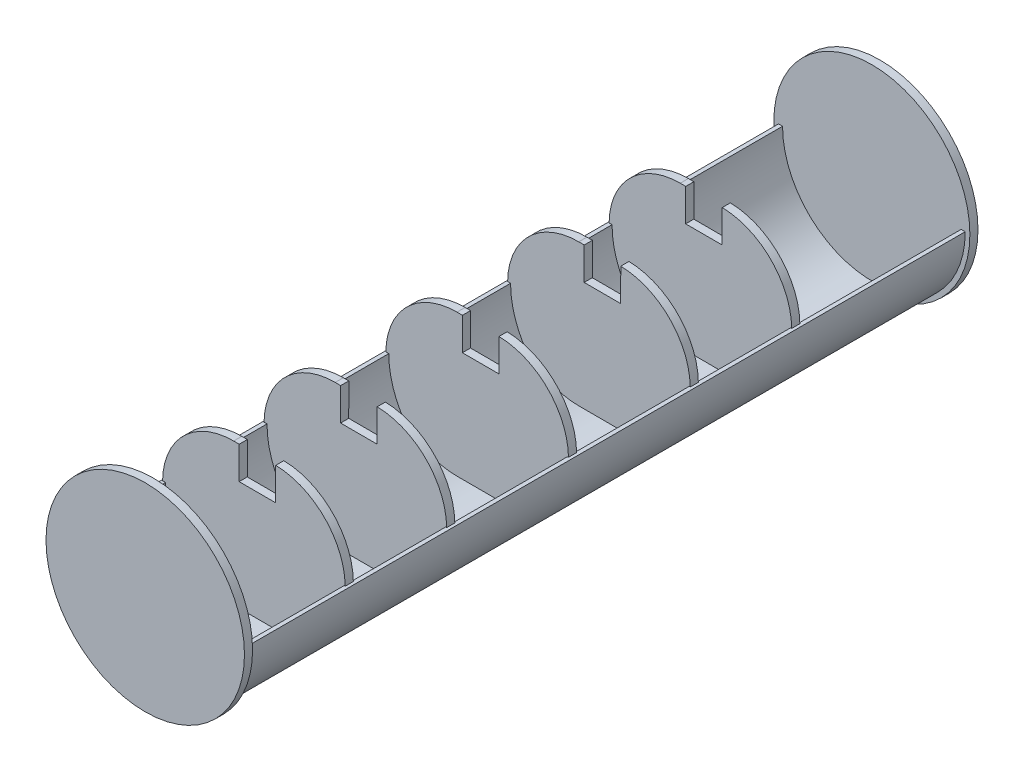
from build123d import *

# Parameters (mm, degrees)
BOSS_EXTRUDE1_DEPTH = 2
LPATTERN1_COUNT     = 2
LPATTERN1_PITCH     = 25
SKETCH7_R           = 24.15
BOSS_EXTRUDE4_DEPTH = 2
LPATTERN2_COUNT     = 3
LPATTERN2_PITCH     = 30
LPATTERN3_START     = 110
LPATTERN3_DEPTH     = 2
SKETCH10_R          = 24.446416427
BOSS_EXTRUDE6_DEPTH = 2
BOSS_EXTRUDE8_DEPTH = 177
CUT_EXTRUDE1_START  = -2
CUT_EXTRUDE1_DEPTH  = 112


# Read off the part's stored shape, not the designer's step: LPattern3
with BuildPart() as part:
    # Sketch2 → Boss-Extrude1 (new body)
    with BuildSketch(Plane.XY):
        with BuildLine():
            Line((-28.088306633, 28.685216936), (-18.088252628, 28.667649742))
            ThreePointArc((-18.088252628, 28.667649742), (-0.619022007, 11.136934368), (-18.14973738, -6.332296253))
            Line((-18.14973738, -6.332296253), (-28.149791386, -6.314729058))
            ThreePointArc((-28.149791386, -6.314729058), (-45.619022007, 11.215986315), (-28.088306633, 28.685216936))
        make_face()
    extrude(amount=BOSS_EXTRUDE1_DEPTH)


with BuildPart() as lpattern1_1:
    # LPattern1: pattern copy
    add(part.part.moved(Location(Vector(0, 0, 1) * (1 * LPATTERN1_PITCH))))


with BuildPart() as body_3:
    # Sketch7 → Boss-Extrude4 (new body)
    with BuildSketch(Plane.XY.offset(-40)):
        with Locations((-22.885176255, 11.436449293)):
            Circle(SKETCH7_R)
    extrude(amount=-BOSS_EXTRUDE4_DEPTH)


with BuildPart() as lpattern2_1:
    # LPattern2: pattern copy
    add(lpattern1_1.part.moved(Location(Vector(0, 0, 1) * (1 * LPATTERN2_PITCH))))


with BuildPart() as lpattern2_2:
    # LPattern2: pattern copy
    add(lpattern1_1.part.moved(Location(Vector(0, 0, 1) * (2 * LPATTERN2_PITCH))))


with BuildPart() as body_6:
    # LPattern3 outline → LPattern3 (new body)
    with BuildSketch(Plane.XY.offset(LPATTERN3_START)):
        with BuildLine():
            ThreePointArc((-28.088306633, 28.685216936), (-45.619022007, 11.215986316), (-28.149791386, -6.314729058))
            Line((-28.149791386, -6.314729058), (-18.14973738, -6.332296253))
            ThreePointArc((-18.14973738, -6.332296253), (-0.619022007, 11.136934369), (-18.088252628, 28.667649742))
            Line((-18.088252628, 28.667649742), (-28.088306633, 28.685216936))
        make_face()
    extrude(amount=LPATTERN3_DEPTH)


with BuildPart() as body_7:
    # Sketch10 → Boss-Extrude6 (new body)
    with BuildSketch(Plane.XY.offset(137)):
        with Locations((-22.885176255, 11.436449293)):
            Circle(SKETCH10_R)
    extrude(amount=BOSS_EXTRUDE6_DEPTH)


with BuildPart() as part_1:
    add(part.part)

    add(lpattern1_1.part)  # Boss-Extrude8 merges LPattern1_1

    add(body_3.part)  # Boss-Extrude8 merges body 3

    add(lpattern2_1.part)  # Boss-Extrude8 merges LPattern2_1

    add(lpattern2_2.part)  # Boss-Extrude8 merges LPattern2_2

    add(body_6.part)  # Boss-Extrude8 merges body 6

    add(body_7.part)  # Boss-Extrude8 merges body 7
    # Sketch8 → Boss-Extrude8 (add)
    with BuildSketch(Plane.XY.offset(-40)):
        with BuildLine():
            Line((-45.885176255, 11.436449293), (-44.885176255, 11.436449293))
            ThreePointArc((-44.885176255, 11.436449293), (-22.885176255, -10.563550707), (-0.885176255, 11.436449293))
            Line((-0.885176255, 11.436449293), (0.114823745, 11.436449293))
            ThreePointArc((0.114823745, 11.436449293), (-22.885176255, -11.563550707), (-45.885176255, 11.436449293))
        make_face()
    extrude(amount=BOSS_EXTRUDE8_DEPTH)

    # Sketch12 → Cut-Extrude1 (cut)
    with BuildSketch(Plane.XY.offset(2).offset(CUT_EXTRUDE1_START)):
        Polygon((-26.739417039, 28.682847328), (-17.739430926, 28.667036963), (-17.753484584, 20.667049308), (-26.753470697, 20.682859673), align=None)
    extrude(amount=CUT_EXTRUDE1_DEPTH, mode=Mode.SUBTRACT)


solid = part_1.part
